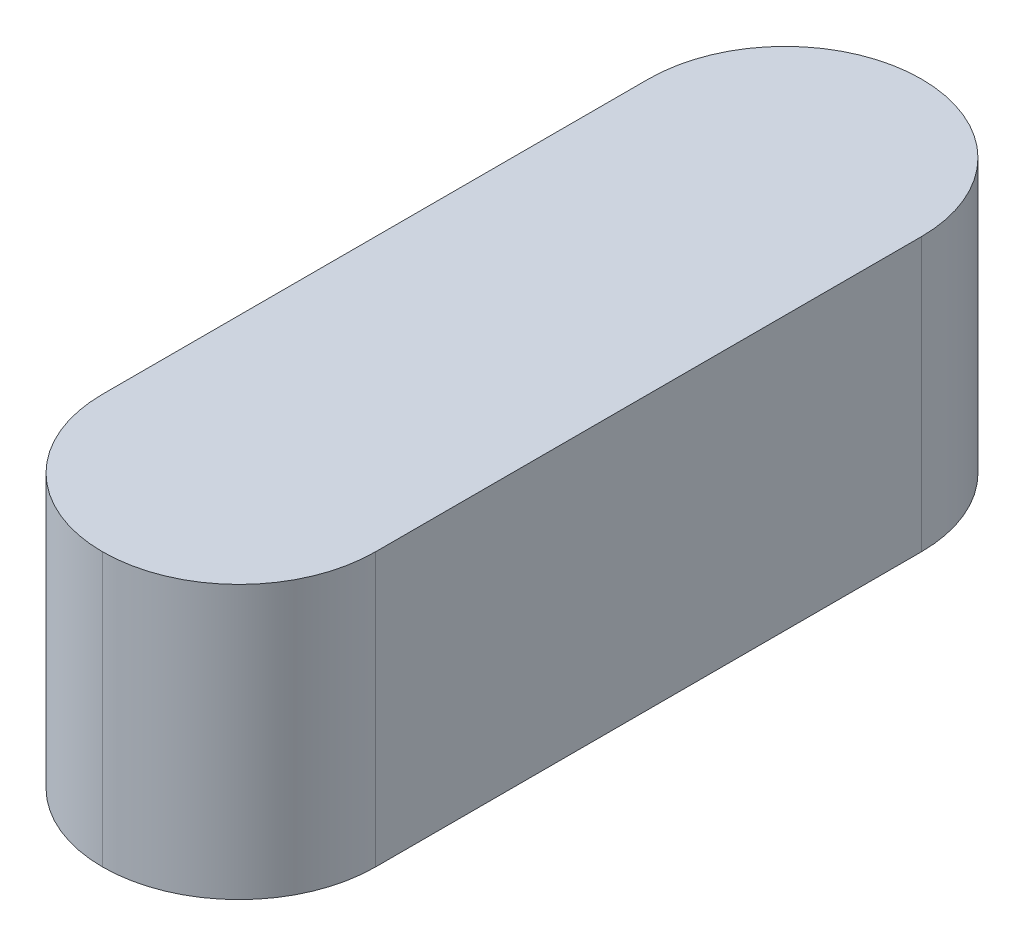
from build123d import *

# Parameters (mm, degrees)
SKETCH1_W      = 6
SKETCH1_H      = 6
EXTRUDE1_DEPTH = 18
FILLET1_R      = 3


with BuildPart() as part:
    # Sketch1 → Extrude1 (new body)
    with BuildSketch(Plane.XY):
        with Locations((3, 7.795)):
            Rectangle(SKETCH1_W, SKETCH1_H)
    extrude(amount=EXTRUDE1_DEPTH)

    # Fillet1
    fillet1_edges = [part.edges().sort_by_distance(p)[0] for p in [
        (0, 7.795, 0),
        (6, 7.795, 0),
        (0, 7.795, 18),
        (6, 7.795, 18),
    ]]
    fillet(fillet1_edges, radius=FILLET1_R - 0.0001)  # a hair under: the kernel refuses the full size


solid = part.part
